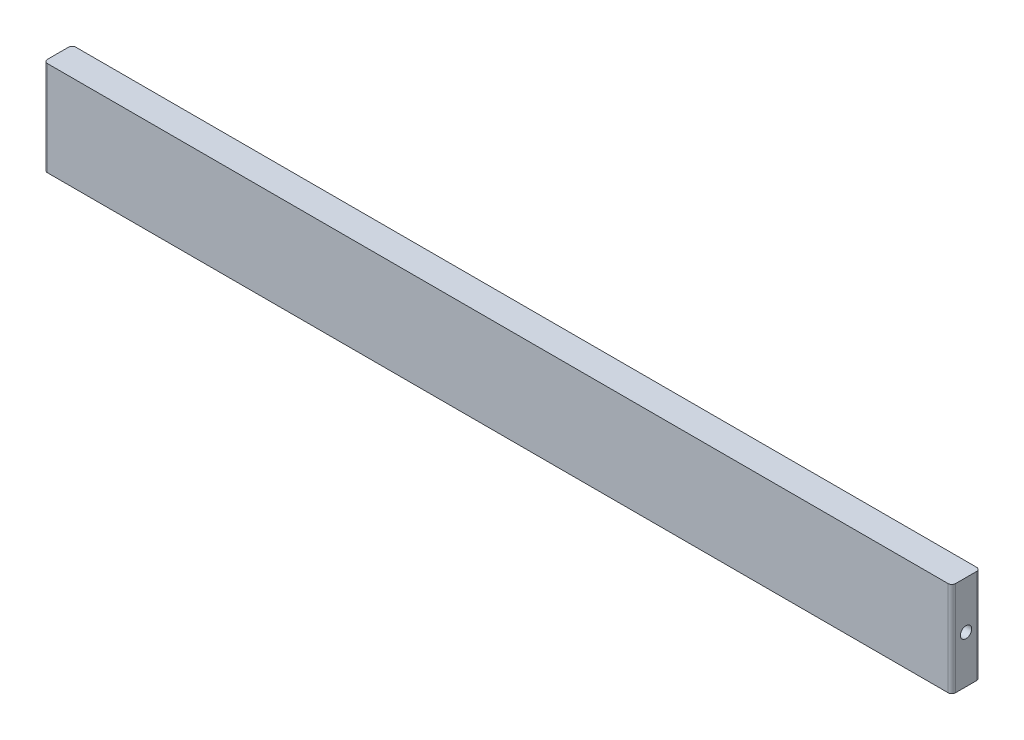
from build123d import *

# Parameters (mm, degrees)
SKETCH1_W                  = 304.8
SKETCH1_H                  = 9.525
BOSS_EXTRUDE1_DEPTH        = 31.75
F_10_24_TAPPED_HOLE1_D     = 3.7973
F_10_24_TAPPED_HOLE1_DEPTH = 19.05
F_10_24_TAPPED_HOLE1_TIP   = 1.140824014
FILLET1_R                  = 1.27


with BuildPart() as part:
    # Sketch1 → Boss-Extrude1 (new body)
    with BuildSketch(Plane(origin=(0, -21, 0), x_dir=(1, 0, 0), z_dir=(0, 1, 0))):
        with Locations((6.69e-07, -174.7625)):
            Rectangle(SKETCH1_W, SKETCH1_H)
    extrude(amount=BOSS_EXTRUDE1_DEPTH)

    # #10-24 Tapped Hole1
    with Locations(Plane(origin=(0, -21, 0), x_dir=(-1, 0, 0), z_dir=(0, -1, 0))):
        with Locations((-127.000000669, -174.7625), (-42.333334002, -174.7625), (126.999999331, -174.7625), (42.333332664, -174.7625)):
            Hole(F_10_24_TAPPED_HOLE1_D / 2, depth=F_10_24_TAPPED_HOLE1_DEPTH)
            with Locations((0, 0, -(F_10_24_TAPPED_HOLE1_DEPTH + F_10_24_TAPPED_HOLE1_TIP / 2))):  # 118° drill point
                Cone(0, F_10_24_TAPPED_HOLE1_D / 2, F_10_24_TAPPED_HOLE1_TIP, mode=Mode.SUBTRACT)

    # Sketch5 → #10-24 Tapped Hole2 (revolve, cut)
    with BuildSketch(Plane(origin=(152.400000669, -5.125, 174.7625), x_dir=(0, 0, -1), z_dir=(0, 1, 0))):
        Polygon((0, 0), (0, 20.190824014), (1.89865, 19.05), (1.89865, 0), align=None)
    f_10_24_tapped_hole2 = revolve(axis=Axis((158.750000669, -5.125, 174.7625), (-1, 0, 0)), mode=Mode.SUBTRACT)

    # Mirror1: #10-24 Tapped Hole2 across plane
    add(f_10_24_tapped_hole2.mirror(Plane(origin=(0, 0, 0), x_dir=(0, 0, 1), z_dir=(1, 0, 0))), mode=Mode.SUBTRACT)

    # Fillet1
    fillet1_edges = [part.edges().sort_by_distance(p)[0] for p in [
        (152.400000669, -5.125, 170),
        (152.400000669, -5.125, 179.525),
        (-152.399999331, -5.125, 170),
        (-152.399999331, -5.125, 179.525),
    ]]
    fillet(fillet1_edges, radius=FILLET1_R)


solid = part.part
